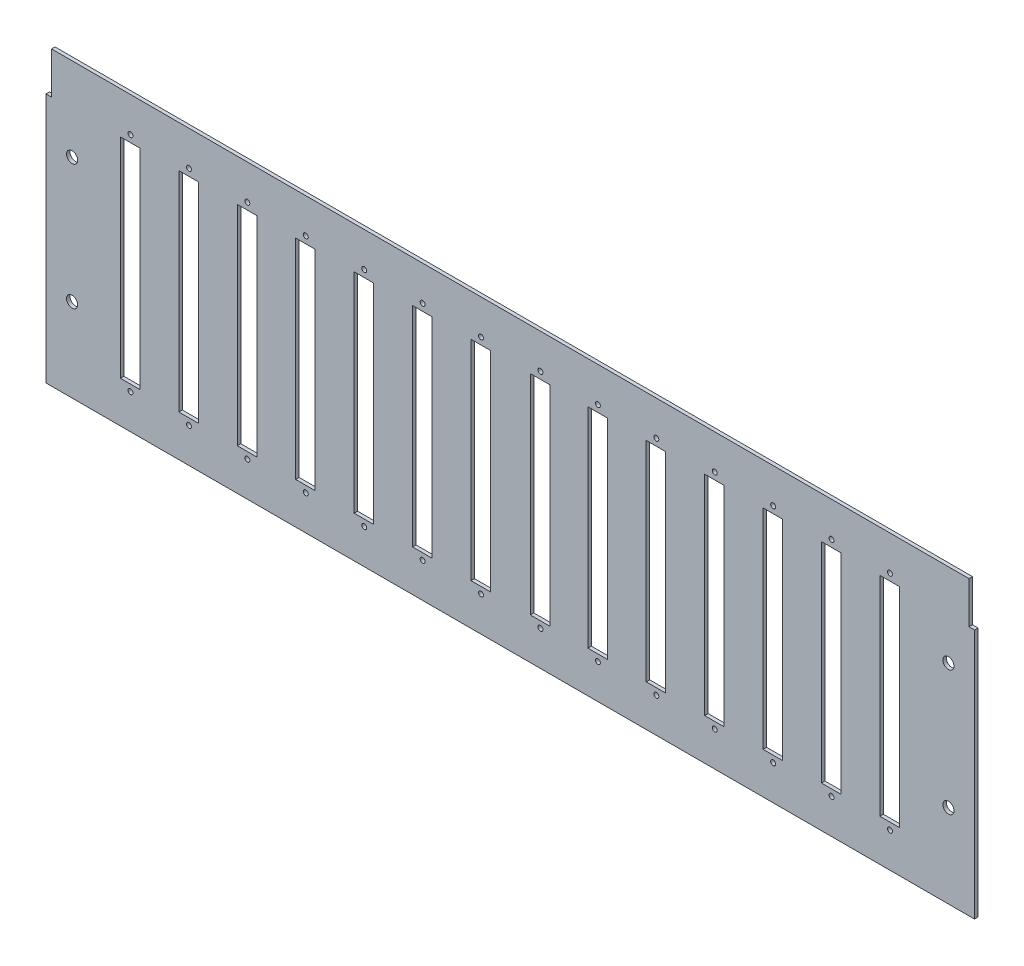
from build123d import *

# Parameters (mm, degrees)
SKETCH1_R           = 1.1303
SKETCH1_R_2         = 2.54
SKETCH1_W           = 8.89
SKETCH1_H           = 95.4405
SKETCH1_H_2         = 95.25
BOSS_EXTRUDE1_DEPTH = 1.5875


with BuildPart() as part:
    # Sketch1 → Boss-Extrude1 (new body)
    with BuildSketch(Plane.XY):
        Polygon((0, 114.3), (0, 0), (423.8752, 0), (423.8752, 114.3), (421.3352, 114.3), (421.3352, 133.35), (2.54, 133.35), (2.54, 114.3), align=None)
        with Locations((38.5826, 15.875)):
            Circle(SKETCH1_R, mode=Mode.SUBTRACT)
        with Locations((65.2526, 15.875)):
            Circle(SKETCH1_R, mode=Mode.SUBTRACT)
        with Locations((91.9226, 15.875)):
            Circle(SKETCH1_R, mode=Mode.SUBTRACT)
        with Locations((118.5926, 15.875)):
            Circle(SKETCH1_R, mode=Mode.SUBTRACT)
        with Locations((145.2626, 15.875)):
            Circle(SKETCH1_R, mode=Mode.SUBTRACT)
        with Locations((171.9326, 15.875)):
            Circle(SKETCH1_R, mode=Mode.SUBTRACT)
        with Locations((198.6026, 15.875)):
            Circle(SKETCH1_R, mode=Mode.SUBTRACT)
        with Locations((11.9126, 38.1)):
            Circle(SKETCH1_R_2, mode=Mode.SUBTRACT)
        with Locations((38.42385, 66.57975)):
            Rectangle(SKETCH1_W, SKETCH1_H, mode=Mode.SUBTRACT)
        with Locations((65.09385, 66.57975)):
            Rectangle(SKETCH1_W, SKETCH1_H, mode=Mode.SUBTRACT)
        with Locations((91.76385, 66.57975)):
            Rectangle(SKETCH1_W, SKETCH1_H, mode=Mode.SUBTRACT)
        with Locations((118.43385, 66.57975)):
            Rectangle(SKETCH1_W, SKETCH1_H, mode=Mode.SUBTRACT)
        with Locations((145.10385, 66.57975)):
            Rectangle(SKETCH1_W, SKETCH1_H, mode=Mode.SUBTRACT)
        with Locations((171.77385, 66.57975)):
            Rectangle(SKETCH1_W, SKETCH1_H, mode=Mode.SUBTRACT)
        with Locations((198.44385, 66.57975)):
            Rectangle(SKETCH1_W, SKETCH1_H, mode=Mode.SUBTRACT)
        with Locations((225.704188438, 15.875)):
            Circle(SKETCH1_R, mode=Mode.SUBTRACT)
        with Locations((251.9426, 15.875)):
            Circle(SKETCH1_R, mode=Mode.SUBTRACT)
        with Locations((278.6126, 15.875)):
            Circle(SKETCH1_R, mode=Mode.SUBTRACT)
        with Locations((305.2826, 15.875)):
            Circle(SKETCH1_R, mode=Mode.SUBTRACT)
        with Locations((331.9526, 15.875)):
            Circle(SKETCH1_R, mode=Mode.SUBTRACT)
        with Locations((358.6226, 15.875)):
            Circle(SKETCH1_R, mode=Mode.SUBTRACT)
        with Locations((385.2926, 15.875)):
            Circle(SKETCH1_R, mode=Mode.SUBTRACT)
        with Locations((225.545438438, 66.57975)):
            Rectangle(SKETCH1_W, SKETCH1_H, mode=Mode.SUBTRACT)
        with Locations((251.78385, 66.57975)):
            Rectangle(SKETCH1_W, SKETCH1_H, mode=Mode.SUBTRACT)
        with Locations((278.45385, 66.57975)):
            Rectangle(SKETCH1_W, SKETCH1_H, mode=Mode.SUBTRACT)
        with Locations((305.12385, 66.57975)):
            Rectangle(SKETCH1_W, SKETCH1_H, mode=Mode.SUBTRACT)
        with Locations((411.9626, 38.1)):
            Circle(SKETCH1_R_2, mode=Mode.SUBTRACT)
        with Locations((331.79385, 66.57975)):
            Rectangle(SKETCH1_W, SKETCH1_H, mode=Mode.SUBTRACT)
        with Locations((358.46385, 66.57975)):
            Rectangle(SKETCH1_W, SKETCH1_H, mode=Mode.SUBTRACT)
        with Locations((11.9126, 95.25)):
            Circle(SKETCH1_R_2, mode=Mode.SUBTRACT)
        with Locations((38.5826, 117.475)):
            Circle(SKETCH1_R, mode=Mode.SUBTRACT)
        with Locations((65.2526, 117.475)):
            Circle(SKETCH1_R, mode=Mode.SUBTRACT)
        with Locations((91.9226, 117.475)):
            Circle(SKETCH1_R, mode=Mode.SUBTRACT)
        with Locations((118.5926, 117.475)):
            Circle(SKETCH1_R, mode=Mode.SUBTRACT)
        with Locations((145.2626, 117.475)):
            Circle(SKETCH1_R, mode=Mode.SUBTRACT)
        with Locations((171.9326, 117.475)):
            Circle(SKETCH1_R, mode=Mode.SUBTRACT)
        with Locations((198.6026, 117.475)):
            Circle(SKETCH1_R, mode=Mode.SUBTRACT)
        with Locations((385.13385, 66.675)):
            Rectangle(SKETCH1_W, SKETCH1_H_2, mode=Mode.SUBTRACT)
        with Locations((411.9626, 95.25)):
            Circle(SKETCH1_R_2, mode=Mode.SUBTRACT)
        with Locations((225.704188438, 117.475)):
            Circle(SKETCH1_R, mode=Mode.SUBTRACT)
        with Locations((251.9426, 117.475)):
            Circle(SKETCH1_R, mode=Mode.SUBTRACT)
        with Locations((278.6126, 117.475)):
            Circle(SKETCH1_R, mode=Mode.SUBTRACT)
        with Locations((305.2826, 117.475)):
            Circle(SKETCH1_R, mode=Mode.SUBTRACT)
        with Locations((331.9526, 117.475)):
            Circle(SKETCH1_R, mode=Mode.SUBTRACT)
        with Locations((358.6226, 117.475)):
            Circle(SKETCH1_R, mode=Mode.SUBTRACT)
        with Locations((385.2926, 117.475)):
            Circle(SKETCH1_R, mode=Mode.SUBTRACT)
    extrude(amount=BOSS_EXTRUDE1_DEPTH)


solid = part.part
